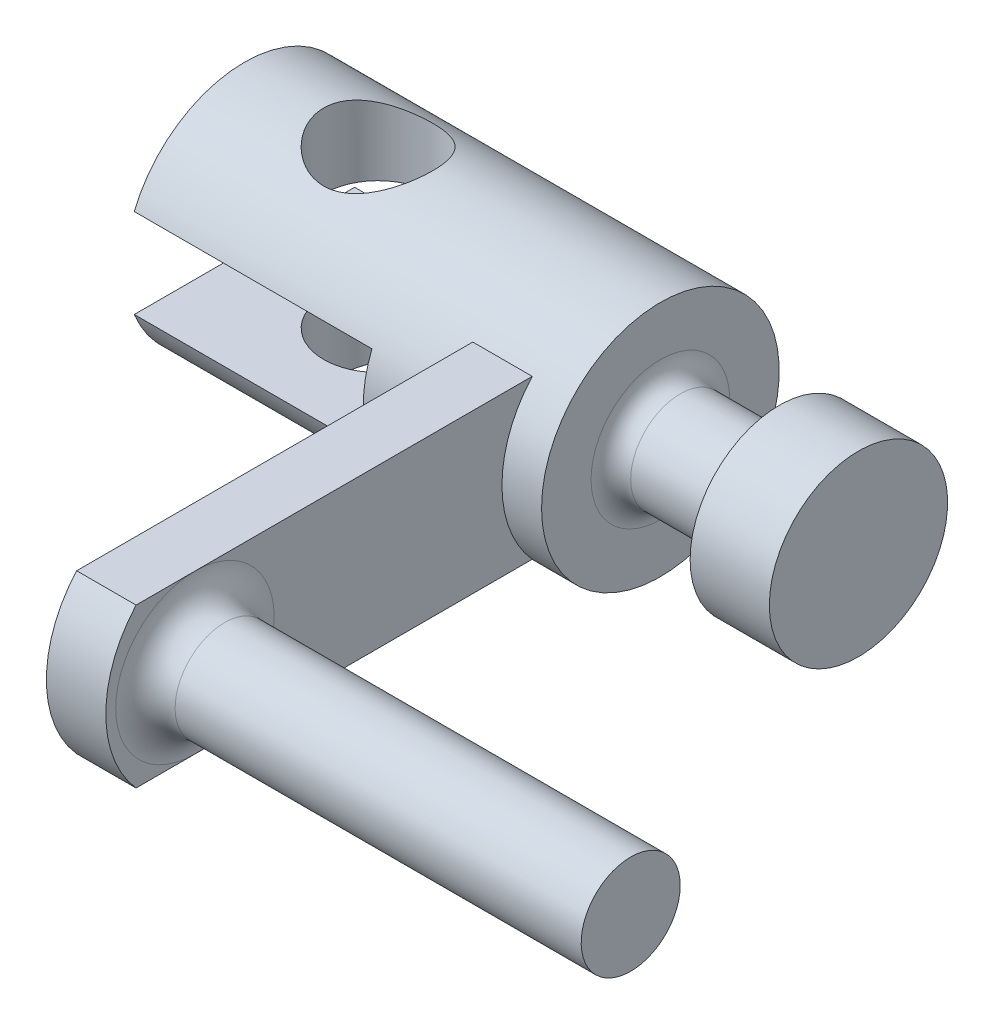
from build123d import *

# Parameters (mm, degrees)
SKETCH2_W               = 20.869986484
SKETCH2_H               = 4.5
CUT_EXTRUDE1_DEPTH      = 12
CUT_EXTRUDE2_DEPTH      = 33.14031736
CUT_EXTRUDE2_DEPTH_BACK = 33.14031736
SKETCH3_R               = 2.75
BOSS_EXTRUDE1_START     = -15
BOSS_EXTRUDE1_DEPTH     = 3
SKETCH6_R               = 2.5
BOSS_EXTRUDE2_DEPTH     = 22
FILLET1_R               = 1
FILLET2_R               = 1.5


# Read off the part's stored shape, not the designer's step: Boss-Extrude1
with BuildPart() as part:
    # Sketch1 → Revolve1 (revolve)
    with BuildSketch(Plane(origin=(0, 0, 0), x_dir=(1, 0, 0), z_dir=(0, 1, 0)), mode=Mode.PRIVATE) as revolve1_sk:
        Polygon((0, 0), (0, 4.5), (-4, 4.5), (-4, 2.5), (-10, 2.5), (-10, 6), (-31, 6), (-31, 0), align=None)
    revolve(revolve1_sk.sketch.rotate(Axis((-13.308467742, 0, 0), (1, 0, 0)), 180), axis=Axis((-13.308467742, 0, 0), (1, 0, 0)))

    # Sketch2 → Cut-Extrude1 (cut)
    with BuildSketch(Plane.ZY.offset(31)):
        Rectangle(SKETCH2_W, SKETCH2_H)
    extrude(amount=-CUT_EXTRUDE1_DEPTH, mode=Mode.SUBTRACT)

    # Sketch3 → Cut-Extrude2 (cut, two sides: drawn at the far end of the back side and taken through both)
    with BuildSketch(Plane(origin=(0, 0, 0), x_dir=(1, 0, 0), z_dir=(0, 1, 0)).offset(-CUT_EXTRUDE2_DEPTH_BACK)):
        with Locations(Location((-24.25, 0, 0), (0, 0, 270))):
            Circle(SKETCH3_R)
    extrude(amount=CUT_EXTRUDE2_DEPTH + CUT_EXTRUDE2_DEPTH_BACK, mode=Mode.SUBTRACT)

    # Boss-Extrude1 outline → Boss-Extrude1 (add)
    with BuildSketch(Plane.YZ.offset(BOSS_EXTRUDE1_START)):
        with BuildLine():
            ThreePointArc((4, 24.472135955), (0, 26), (-4, 24.472135955))
            Line((-4, 24.472135955), (-4, 4.472135955))
            ThreePointArc((-4, 4.472135955), (0, 6), (4, 4.472135955))
            Line((4, 4.472135955), (4, 24.472135955))
        make_face()
    extrude(amount=BOSS_EXTRUDE1_DEPTH)

    # Sketch6 → Boss-Extrude2 (add)
    with BuildSketch(Plane(origin=(-12, 0, 0), x_dir=(0, 0, -1), z_dir=(1, 0, 0))):
        with Locations((-21.5, 0)):
            Circle(SKETCH6_R)
    extrude(amount=BOSS_EXTRUDE2_DEPTH)

    # Fillet1
    fillet1_edges = [part.edges().sort_by_distance(p)[0] for p in [
        (-10, 0, -2.5),
    ]]
    fillet(fillet1_edges, radius=FILLET1_R)

    # Fillet2
    fillet2_edges = [part.edges().sort_by_distance(p)[0] for p in [
        (-12, 0, 24),
    ]]
    fillet(fillet2_edges, radius=FILLET2_R - 0.0001)  # a hair under: the kernel refuses the full size


solid = part.part
